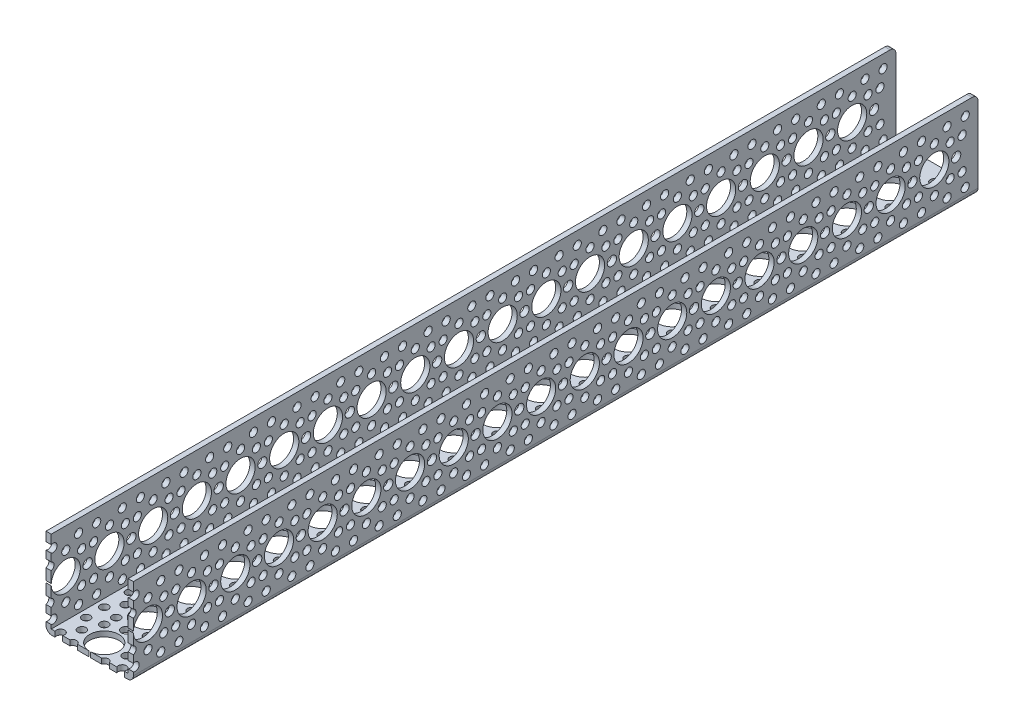
from build123d import *

# Parameters (mm, degrees)
SKETCH1_W                 = 381
SKETCH1_H                 = 38.1
BOSS_EXTRUDE1_DEPTH       = 38.1
SKETCH2_W                 = 33.528
SKETCH2_H                 = 35.814
CUT_EXTRUDE1_DEPTH        = 385.791138152
HOLE1_D                   = 12.7254
HOLE1_DEPTH               = 2.286
F_5_CLEARANCE_HOLE1_D     = 3.556
F_5_CLEARANCE_HOLE1_DEPTH = 2.286
F_6_CLEARANCE_HOLE1_D     = 4.064
F_6_CLEARANCE_HOLE1_DEPTH = 2.286
HOLE2_D                   = 12.7254
HOLE2_DEPTH               = 38.1
F_6_CLEARANCE_HOLE2_D     = 4.064
F_6_CLEARANCE_HOLE2_DEPTH = 38.1
F_5_CLEARANCE_HOLE2_D     = 3.556
F_5_CLEARANCE_HOLE2_DEPTH = 38.1
HOLE3_D                   = 12.7254
HOLE3_DEPTH               = 38.1
F_6_CLEARANCE_HOLE3_D     = 4.064
F_6_CLEARANCE_HOLE3_DEPTH = 38.1
F_5_CLEARANCE_HOLE3_D     = 3.556
F_5_CLEARANCE_HOLE3_DEPTH = 38.1
FILLET1_R                 = 2.54
SKETCH21_W                = 12.7
SKETCH21_H                = 99.950551067
CUT_EXTRUDE2_DEPTH        = 76.2


with BuildPart() as part:
    # Sketch1 → Boss-Extrude1 (new body)
    with BuildSketch(Plane(origin=(38.1, 0, 0), x_dir=(0, 0, -1), z_dir=(1, 0, 0))):
        with Locations((-190.5, 19.05)):
            Rectangle(SKETCH1_W, SKETCH1_H)
    extrude(amount=-BOSS_EXTRUDE1_DEPTH)

    # Sketch2 → Cut-Extrude1 (cut, through all)
    with BuildSketch(Plane.XY.offset(381)):
        with Locations((19.05, 20.193)):
            Rectangle(SKETCH2_W, SKETCH2_H)
    extrude(amount=-CUT_EXTRUDE1_DEPTH, mode=Mode.SUBTRACT)

    # Hole1
    with Locations(Plane.ZY):
        with Locations((38.1, 19.05), (19.05, 19.05), (57.15, 19.05), (76.2, 19.05), (95.25, 19.05), (114.3, 19.05), (133.35, 19.05), (152.4, 19.05), (171.45, 19.05), (190.5, 19.05), (209.55, 19.05), (228.6, 19.05), (247.65, 19.05), (266.7, 19.05), (285.75, 19.05), (304.8, 19.05), (323.85, 19.05), (342.9, 19.05), (361.95, 19.05)):
            Hole(HOLE1_D / 2, depth=HOLE1_DEPTH)

    # #5 Clearance Hole1
    with Locations(Plane.ZY):
        with Locations((367.529615818, 5.579615818), (374.085202787, 12.135202787), (367.529615818, 32.520384182), (374.085202787, 25.964797213), (13.470384182, 5.579615818), (6.914797213, 12.135202787), (13.470384182, 32.520384182), (6.914797213, 25.964797213), (348.479615818, 5.579615818), (329.429615818, 5.579615818), (310.379615818, 5.579615818), (291.329615818, 5.579615818), (272.279615818, 5.579615818), (253.229615818, 5.579615818), (234.179615818, 5.579615818), (215.129615818, 5.579615818), (196.079615818, 5.579615818), (177.029615818, 5.579615818), (157.979615818, 5.579615818), (138.929615818, 5.579615818), (119.879615818, 5.579615818), (100.829615818, 5.579615818), (81.779615818, 5.579615818), (62.729615818, 5.579615818), (43.679615818, 5.579615818), (24.629615818, 5.579615818), (348.479615818, 32.520384182), (329.429615818, 32.520384182), (310.379615818, 32.520384182), (291.329615818, 32.520384182), (272.279615818, 32.520384182), (253.229615818, 32.520384182), (234.179615818, 32.520384182), (215.129615818, 32.520384182), (196.079615818, 32.520384182), (177.029615818, 32.520384182), (157.979615818, 32.520384182), (138.929615818, 32.520384182), (119.879615818, 32.520384182), (100.829615818, 32.520384182), (81.779615818, 32.520384182), (62.729615818, 32.520384182), (43.679615818, 32.520384182), (24.629615818, 32.520384182), (375.420384182, 5.579615818), (375.420384182, 32.520384182), (356.370384182, 5.579615818), (356.370384182, 32.520384182), (337.320384182, 5.579615818), (337.320384182, 32.520384182), (318.270384182, 5.579615818), (318.270384182, 32.520384182), (299.220384182, 5.579615818), (299.220384182, 32.520384182), (280.170384182, 5.579615818), (280.170384182, 32.520384182), (261.120384182, 5.579615818), (261.120384182, 32.520384182), (242.070384182, 5.579615818), (242.070384182, 32.520384182), (223.020384182, 5.579615818), (223.020384182, 32.520384182), (203.970384182, 5.579615818), (203.970384182, 32.520384182), (184.920384182, 5.579615818), (184.920384182, 32.520384182), (165.870384182, 5.579615818), (165.870384182, 32.520384182), (146.820384182, 5.579615818), (146.820384182, 32.520384182), (127.770384182, 5.579615818), (127.770384182, 32.520384182), (108.720384182, 5.579615818), (108.720384182, 32.520384182), (89.670384182, 5.579615818), (89.670384182, 32.520384182), (70.620384182, 5.579615818), (70.620384182, 32.520384182), (51.570384182, 5.579615818), (51.570384182, 32.520384182), (355.035202787, 12.135202787), (361.95, 9.271), (368.864797213, 12.135202787), (368.864797213, 25.964797213), (361.95, 28.829), (335.985202787, 12.135202787), (342.9, 9.271), (349.814797213, 12.135202787), (349.814797213, 25.964797213), (342.9, 28.829), (316.935202787, 12.135202787), (323.85, 9.271), (330.764797213, 12.135202787), (330.764797213, 25.964797213), (323.85, 28.829), (297.885202787, 12.135202787), (304.8, 9.271), (311.714797213, 12.135202787), (311.714797213, 25.964797213), (304.8, 28.829), (278.835202787, 12.135202787), (285.75, 9.271), (292.664797213, 12.135202787), (292.664797213, 25.964797213), (285.75, 28.829), (259.785202787, 12.135202787), (266.7, 9.271), (273.614797213, 12.135202787), (273.614797213, 25.964797213), (266.7, 28.829), (240.735202787, 12.135202787), (247.65, 9.271), (254.564797213, 12.135202787), (254.564797213, 25.964797213), (247.65, 28.829), (221.685202787, 12.135202787), (228.6, 9.271), (235.514797213, 12.135202787), (235.514797213, 25.964797213), (228.6, 28.829), (202.635202787, 12.135202787), (209.55, 9.271), (216.464797213, 12.135202787), (216.464797213, 25.964797213), (209.55, 28.829), (183.585202787, 12.135202787), (190.5, 9.271), (197.414797213, 12.135202787), (197.414797213, 25.964797213), (190.5, 28.829), (164.535202787, 12.135202787), (171.45, 9.271), (178.364797213, 12.135202787), (178.364797213, 25.964797213), (171.45, 28.829), (145.485202787, 12.135202787), (152.4, 9.271), (159.314797213, 12.135202787), (159.314797213, 25.964797213), (152.4, 28.829), (126.435202787, 12.135202787), (133.35, 9.271), (140.264797213, 12.135202787), (140.264797213, 25.964797213), (133.35, 28.829), (107.385202787, 12.135202787), (114.3, 9.271), (121.214797213, 12.135202787), (121.214797213, 25.964797213), (114.3, 28.829), (88.335202787, 12.135202787), (95.25, 9.271), (102.164797213, 12.135202787), (102.164797213, 25.964797213), (95.25, 28.829), (69.285202787, 12.135202787), (76.2, 9.271), (83.114797213, 12.135202787), (83.114797213, 25.964797213), (76.2, 28.829), (50.235202787, 12.135202787), (57.15, 9.271), (64.064797213, 12.135202787), (64.064797213, 25.964797213), (57.15, 28.829), (31.185202787, 12.135202787), (38.1, 9.271), (45.014797213, 12.135202787), (45.014797213, 25.964797213), (38.1, 28.829), (355.035202787, 25.964797213), (335.985202787, 25.964797213), (316.935202787, 25.964797213), (297.885202787, 25.964797213), (278.835202787, 25.964797213), (259.785202787, 25.964797213), (240.735202787, 25.964797213), (221.685202787, 25.964797213), (202.635202787, 25.964797213), (183.585202787, 25.964797213), (164.535202787, 25.964797213), (145.485202787, 25.964797213), (126.435202787, 25.964797213), (107.385202787, 25.964797213), (88.335202787, 25.964797213), (69.285202787, 25.964797213), (50.235202787, 25.964797213), (31.185202787, 25.964797213), (32.520384182, 5.579615818), (32.520384182, 32.520384182), (5.579615818, 5.579615818), (5.579615818, 32.520384182), (12.135202787, 12.135202787), (19.05, 9.271), (25.964797213, 12.135202787), (25.964797213, 25.964797213), (19.05, 28.829), (12.135202787, 25.964797213)):
            Hole(F_5_CLEARANCE_HOLE1_D / 2, depth=F_5_CLEARANCE_HOLE1_DEPTH)

    # #6 Clearance Hole1
    with Locations(Plane.ZY):
        with Locations((371.475, 19.05), (352.425, 19.05), (333.375, 19.05), (314.325, 19.05), (295.275, 19.05), (276.225, 19.05), (257.175, 19.05), (238.125, 19.05), (219.075, 19.05), (200.025, 19.05), (180.975, 19.05), (161.925, 19.05), (142.875, 19.05), (123.825, 19.05), (104.775, 19.05), (85.725, 19.05), (66.675, 19.05), (47.625, 19.05), (28.575, 19.05), (9.525, 19.05)):
            Hole(F_6_CLEARANCE_HOLE1_D / 2, depth=F_6_CLEARANCE_HOLE1_DEPTH)

    # Hole2
    with Locations(Plane(origin=(0, 0, 0), x_dir=(-1, 0, 0), z_dir=(0, -1, 0))):
        with Locations((-19.05, -361.95), (-19.05, -342.9), (-19.05, -323.85), (-19.05, -304.8), (-19.05, -285.75), (-19.05, -266.7), (-19.05, -247.65), (-19.05, -228.6), (-19.05, -209.55), (-19.05, -190.5), (-19.05, -171.45), (-19.05, -152.4), (-19.05, -133.35), (-19.05, -114.3), (-19.05, -95.25), (-19.05, -76.2), (-19.05, -57.15), (-19.05, -38.1), (-19.05, -19.05)):
            Hole(HOLE2_D / 2, depth=HOLE2_DEPTH)

    # #6 Clearance Hole2
    with Locations(Plane(origin=(0, 0, 0), x_dir=(-1, 0, 0), z_dir=(0, -1, 0))):
        with Locations((-19.05, -371.475), (-19.05, -352.425), (-19.05, -333.375), (-19.05, -314.325), (-19.05, -295.275), (-19.05, -276.225), (-19.05, -257.175), (-19.05, -238.125), (-19.05, -219.075), (-19.05, -200.025), (-19.05, -180.975), (-19.05, -161.925), (-19.05, -142.875), (-19.05, -123.825), (-19.05, -104.775), (-19.05, -85.725), (-19.05, -66.675), (-19.05, -47.625), (-19.05, -28.575), (-19.05, -9.525)):
            Hole(F_6_CLEARANCE_HOLE2_D / 2, depth=F_6_CLEARANCE_HOLE2_DEPTH)

    # #5 Clearance Hole2
    with Locations(Plane(origin=(0, 0, 0), x_dir=(-1, 0, 0), z_dir=(0, -1, 0))):
        with Locations((-5.579615818, -375.420384182), (-5.579615818, -367.529615818), (-12.135202787, -374.085202787), (-32.520384182, -375.420384182), (-32.520384182, -367.529615818), (-25.964797213, -374.085202787), (-5.579615818, -356.370384182), (-5.579615818, -348.479615818), (-32.520384182, -356.370384182), (-32.520384182, -348.479615818), (-5.579615818, -337.320384182), (-5.579615818, -329.429615818), (-32.520384182, -337.320384182), (-32.520384182, -329.429615818), (-5.579615818, -318.270384182), (-5.579615818, -310.379615818), (-32.520384182, -318.270384182), (-32.520384182, -310.379615818), (-5.579615818, -299.220384182), (-5.579615818, -291.329615818), (-32.520384182, -299.220384182), (-32.520384182, -291.329615818), (-5.579615818, -280.170384182), (-5.579615818, -272.279615818), (-32.520384182, -280.170384182), (-32.520384182, -272.279615818), (-5.579615818, -261.120384182), (-5.579615818, -253.229615818), (-32.520384182, -261.120384182), (-32.520384182, -253.229615818), (-5.579615818, -242.070384182), (-5.579615818, -234.179615818), (-32.520384182, -242.070384182), (-32.520384182, -234.179615818), (-5.579615818, -223.020384182), (-5.579615818, -215.129615818), (-32.520384182, -223.020384182), (-32.520384182, -215.129615818), (-5.579615818, -203.970384182), (-5.579615818, -196.079615818), (-32.520384182, -203.970384182), (-32.520384182, -196.079615818), (-5.579615818, -184.920384182), (-5.579615818, -177.029615818), (-32.520384182, -184.920384182), (-32.520384182, -177.029615818), (-5.579615818, -165.870384182), (-5.579615818, -157.979615818), (-32.520384182, -165.870384182), (-32.520384182, -157.979615818), (-5.579615818, -146.820384182), (-5.579615818, -138.929615818), (-32.520384182, -146.820384182), (-32.520384182, -138.929615818), (-5.579615818, -127.770384182), (-5.579615818, -119.879615818), (-32.520384182, -127.770384182), (-32.520384182, -119.879615818), (-5.579615818, -108.720384182), (-5.579615818, -100.829615818), (-32.520384182, -108.720384182), (-32.520384182, -100.829615818), (-5.579615818, -89.670384182), (-5.579615818, -81.779615818), (-32.520384182, -89.670384182), (-32.520384182, -81.779615818), (-5.579615818, -70.620384182), (-5.579615818, -62.729615818), (-32.520384182, -70.620384182), (-32.520384182, -62.729615818), (-5.579615818, -51.570384182), (-5.579615818, -43.679615818), (-32.520384182, -51.570384182), (-32.520384182, -43.679615818), (-12.135202787, -355.035202787), (-9.271, -361.95), (-12.135202787, -368.864797213), (-25.964797213, -368.864797213), (-28.829, -361.95), (-25.964797213, -355.035202787), (-12.135202787, -335.985202787), (-9.271, -342.9), (-12.135202787, -349.814797213), (-25.964797213, -349.814797213), (-28.829, -342.9), (-25.964797213, -335.985202787), (-12.135202787, -316.935202787), (-9.271, -323.85), (-12.135202787, -330.764797213), (-25.964797213, -330.764797213), (-28.829, -323.85), (-25.964797213, -316.935202787), (-12.135202787, -297.885202787), (-9.271, -304.8), (-12.135202787, -311.714797213), (-25.964797213, -311.714797213), (-28.829, -304.8), (-25.964797213, -297.885202787), (-12.135202787, -278.835202787), (-9.271, -285.75), (-12.135202787, -292.664797213), (-25.964797213, -292.664797213), (-28.829, -285.75), (-25.964797213, -278.835202787), (-12.135202787, -259.785202787), (-9.271, -266.7), (-12.135202787, -273.614797213), (-25.964797213, -273.614797213), (-28.829, -266.7), (-25.964797213, -259.785202787), (-12.135202787, -240.735202787), (-9.271, -247.65), (-12.135202787, -254.564797213), (-25.964797213, -254.564797213), (-28.829, -247.65), (-25.964797213, -240.735202787), (-12.135202787, -221.685202787), (-9.271, -228.6), (-12.135202787, -235.514797213), (-25.964797213, -235.514797213), (-28.829, -228.6), (-25.964797213, -221.685202787), (-12.135202787, -202.635202787), (-9.271, -209.55), (-12.135202787, -216.464797213), (-25.964797213, -216.464797213), (-28.829, -209.55), (-25.964797213, -202.635202787), (-12.135202787, -183.585202787), (-9.271, -190.5), (-12.135202787, -197.414797213), (-25.964797213, -197.414797213), (-28.829, -190.5), (-25.964797213, -183.585202787), (-12.135202787, -164.535202787), (-9.271, -171.45), (-12.135202787, -178.364797213), (-25.964797213, -178.364797213), (-28.829, -171.45), (-25.964797213, -164.535202787), (-12.135202787, -145.485202787), (-9.271, -152.4), (-12.135202787, -159.314797213), (-25.964797213, -159.314797213), (-28.829, -152.4), (-25.964797213, -145.485202787), (-12.135202787, -126.435202787), (-9.271, -133.35), (-12.135202787, -140.264797213), (-25.964797213, -140.264797213), (-28.829, -133.35), (-25.964797213, -126.435202787), (-12.135202787, -107.385202787), (-9.271, -114.3), (-12.135202787, -121.214797213), (-25.964797213, -121.214797213), (-28.829, -114.3), (-25.964797213, -107.385202787), (-12.135202787, -88.335202787), (-9.271, -95.25), (-12.135202787, -102.164797213), (-25.964797213, -102.164797213), (-28.829, -95.25), (-25.964797213, -88.335202787), (-12.135202787, -69.285202787), (-9.271, -76.2), (-12.135202787, -83.114797213), (-25.964797213, -83.114797213), (-28.829, -76.2), (-25.964797213, -69.285202787), (-12.135202787, -50.235202787), (-9.271, -57.15), (-12.135202787, -64.064797213), (-25.964797213, -64.064797213), (-28.829, -57.15), (-25.964797213, -50.235202787), (-9.271, -38.1), (-12.135202787, -45.014797213), (-25.964797213, -45.014797213), (-28.829, -38.1), (-5.579615818, -32.520384182), (-5.579615818, -24.629615818), (-12.135202787, -31.185202787), (-32.520384182, -32.520384182), (-32.520384182, -24.629615818), (-25.964797213, -31.185202787), (-5.579615818, -5.579615818), (-5.579615818, -13.470384182), (-12.135202787, -6.914797213), (-32.520384182, -5.579615818), (-32.520384182, -13.470384182), (-25.964797213, -6.914797213), (-12.135202787, -12.135202787), (-9.271, -19.05), (-12.135202787, -25.964797213), (-25.964797213, -25.964797213), (-28.829, -19.05), (-25.964797213, -12.135202787)):
            Hole(F_5_CLEARANCE_HOLE2_D / 2, depth=F_5_CLEARANCE_HOLE2_DEPTH)

    # Hole3
    with Locations(Plane(origin=(38.1, 0, 0), x_dir=(0, 0, -1), z_dir=(1, 0, 0))):
        with Locations((-38.1, 19.05), (-19.05, 19.05), (-57.15, 19.05), (-76.2, 19.05), (-95.25, 19.05), (-114.3, 19.05), (-133.35, 19.05), (-152.4, 19.05), (-171.45, 19.05), (-190.5, 19.05), (-209.55, 19.05), (-228.6, 19.05), (-247.65, 19.05), (-266.7, 19.05), (-285.75, 19.05), (-304.8, 19.05), (-323.85, 19.05), (-342.9, 19.05), (-361.95, 19.05)):
            Hole(HOLE3_D / 2, depth=HOLE3_DEPTH)

    # #6 Clearance Hole3
    with Locations(Plane(origin=(38.1, 0, 0), x_dir=(0, 0, -1), z_dir=(1, 0, 0))):
        with Locations((-352.425, 19.05), (-314.325, 19.05), (-276.225, 19.05), (-238.125, 19.05), (-200.025, 19.05), (-161.925, 19.05), (-123.825, 19.05), (-85.725, 19.05), (-47.625, 19.05), (-28.575, 19.05), (-9.525, 19.05), (-66.675, 19.05), (-104.775, 19.05), (-142.875, 19.05), (-180.975, 19.05), (-219.075, 19.05), (-257.175, 19.05), (-295.275, 19.05), (-333.375, 19.05), (-371.475, 19.05)):
            Hole(F_6_CLEARANCE_HOLE3_D / 2, depth=F_6_CLEARANCE_HOLE3_DEPTH)

    # #5 Clearance Hole3
    with Locations(Plane(origin=(38.1, 0, 0), x_dir=(0, 0, -1), z_dir=(1, 0, 0))):
        with Locations((-367.529615818, 5.579615818), (-367.529615818, 32.520384182), (-13.470384182, 5.579615818), (-348.479615818, 5.579615818), (-310.379615818, 5.579615818), (-272.279615818, 5.579615818), (-234.179615818, 5.579615818), (-196.079615818, 5.579615818), (-157.979615818, 5.579615818), (-119.879615818, 5.579615818), (-81.779615818, 5.579615818), (-43.679615818, 5.579615818), (-348.479615818, 32.520384182), (-310.379615818, 32.520384182), (-272.279615818, 32.520384182), (-234.179615818, 32.520384182), (-196.079615818, 32.520384182), (-157.979615818, 32.520384182), (-119.879615818, 32.520384182), (-81.779615818, 32.520384182), (-43.679615818, 32.520384182), (-375.420384182, 5.579615818), (-356.370384182, 5.579615818), (-337.320384182, 5.579615818), (-318.270384182, 5.579615818), (-299.220384182, 5.579615818), (-280.170384182, 5.579615818), (-261.120384182, 5.579615818), (-242.070384182, 5.579615818), (-223.020384182, 5.579615818), (-203.970384182, 5.579615818), (-184.920384182, 5.579615818), (-165.870384182, 5.579615818), (-146.820384182, 5.579615818), (-127.770384182, 5.579615818), (-108.720384182, 5.579615818), (-89.670384182, 5.579615818), (-70.620384182, 5.579615818), (-51.570384182, 5.579615818), (-361.95, 9.271), (-368.864797213, 25.964797213), (-335.985202787, 12.135202787), (-349.814797213, 12.135202787), (-342.9, 28.829), (-323.85, 9.271), (-330.764797213, 25.964797213), (-297.885202787, 12.135202787), (-311.714797213, 12.135202787), (-304.8, 28.829), (-285.75, 9.271), (-292.664797213, 25.964797213), (-259.785202787, 12.135202787), (-273.614797213, 12.135202787), (-266.7, 28.829), (-247.65, 9.271), (-254.564797213, 25.964797213), (-221.685202787, 12.135202787), (-235.514797213, 12.135202787), (-228.6, 28.829), (-209.55, 9.271), (-216.464797213, 25.964797213), (-183.585202787, 12.135202787), (-197.414797213, 12.135202787), (-190.5, 28.829), (-171.45, 9.271), (-178.364797213, 25.964797213), (-145.485202787, 12.135202787), (-159.314797213, 12.135202787), (-152.4, 28.829), (-133.35, 9.271), (-140.264797213, 25.964797213), (-107.385202787, 12.135202787), (-121.214797213, 12.135202787), (-114.3, 28.829), (-95.25, 9.271), (-102.164797213, 25.964797213), (-69.285202787, 12.135202787), (-83.114797213, 12.135202787), (-76.2, 28.829), (-57.15, 9.271), (-64.064797213, 25.964797213), (-31.185202787, 12.135202787), (-45.014797213, 12.135202787), (-38.1, 28.829), (-335.985202787, 25.964797213), (-297.885202787, 25.964797213), (-259.785202787, 25.964797213), (-221.685202787, 25.964797213), (-183.585202787, 25.964797213), (-145.485202787, 25.964797213), (-107.385202787, 25.964797213), (-69.285202787, 25.964797213), (-31.185202787, 25.964797213), (-32.520384182, 5.579615818), (-32.520384182, 32.520384182), (-5.579615818, 5.579615818), (-5.579615818, 32.520384182), (-12.135202787, 12.135202787), (-19.05, 9.271), (-25.964797213, 12.135202787), (-25.964797213, 25.964797213), (-19.05, 28.829), (-12.135202787, 25.964797213), (-50.235202787, 25.964797213), (-88.335202787, 25.964797213), (-126.435202787, 25.964797213), (-164.535202787, 25.964797213), (-202.635202787, 25.964797213), (-240.735202787, 25.964797213), (-278.835202787, 25.964797213), (-316.935202787, 25.964797213), (-355.035202787, 25.964797213), (-45.014797213, 25.964797213), (-38.1, 9.271), (-57.15, 28.829), (-64.064797213, 12.135202787), (-50.235202787, 12.135202787), (-83.114797213, 25.964797213), (-76.2, 9.271), (-95.25, 28.829), (-102.164797213, 12.135202787), (-88.335202787, 12.135202787), (-121.214797213, 25.964797213), (-114.3, 9.271), (-133.35, 28.829), (-140.264797213, 12.135202787), (-126.435202787, 12.135202787), (-159.314797213, 25.964797213), (-152.4, 9.271), (-171.45, 28.829), (-178.364797213, 12.135202787), (-164.535202787, 12.135202787), (-197.414797213, 25.964797213), (-190.5, 9.271), (-209.55, 28.829), (-216.464797213, 12.135202787), (-202.635202787, 12.135202787), (-235.514797213, 25.964797213), (-228.6, 9.271), (-247.65, 28.829), (-254.564797213, 12.135202787), (-240.735202787, 12.135202787), (-273.614797213, 25.964797213), (-266.7, 9.271), (-285.75, 28.829), (-292.664797213, 12.135202787), (-278.835202787, 12.135202787), (-311.714797213, 25.964797213), (-304.8, 9.271), (-323.85, 28.829), (-330.764797213, 12.135202787), (-316.935202787, 12.135202787), (-349.814797213, 25.964797213), (-342.9, 9.271), (-361.95, 28.829), (-368.864797213, 12.135202787), (-355.035202787, 12.135202787), (-51.570384182, 32.520384182), (-70.620384182, 32.520384182), (-89.670384182, 32.520384182), (-108.720384182, 32.520384182), (-127.770384182, 32.520384182), (-146.820384182, 32.520384182), (-165.870384182, 32.520384182), (-184.920384182, 32.520384182), (-203.970384182, 32.520384182), (-223.020384182, 32.520384182), (-242.070384182, 32.520384182), (-261.120384182, 32.520384182), (-280.170384182, 32.520384182), (-299.220384182, 32.520384182), (-318.270384182, 32.520384182), (-337.320384182, 32.520384182), (-356.370384182, 32.520384182), (-375.420384182, 32.520384182), (-24.629615818, 32.520384182), (-62.729615818, 32.520384182), (-100.829615818, 32.520384182), (-138.929615818, 32.520384182), (-177.029615818, 32.520384182), (-215.129615818, 32.520384182), (-253.229615818, 32.520384182), (-291.329615818, 32.520384182), (-329.429615818, 32.520384182), (-24.629615818, 5.579615818), (-62.729615818, 5.579615818), (-100.829615818, 5.579615818), (-138.929615818, 5.579615818), (-177.029615818, 5.579615818), (-215.129615818, 5.579615818), (-253.229615818, 5.579615818), (-291.329615818, 5.579615818), (-329.429615818, 5.579615818), (-6.914797213, 25.964797213), (-13.470384182, 32.520384182), (-6.914797213, 12.135202787), (-374.085202787, 25.964797213), (-374.085202787, 12.135202787)):
            Hole(F_5_CLEARANCE_HOLE3_D / 2, depth=F_5_CLEARANCE_HOLE3_DEPTH)

    # Fillet1
    fillet1_edges = [part.edges().sort_by_distance(p)[0] for p in [
        (0, 0, 190.5),
        (1.143, 38.1, 381),
        (1.143, 38.1, 0),
        (36.957, 38.1, 381),
        (36.957, 38.1, 0),
        (38.1, 0, 190.5),
    ]]
    fillet(fillet1_edges, radius=FILLET1_R)

    # Sketch21 → Cut-Extrude2 (cut)
    with BuildSketch(Plane(origin=(38.1, 0, 0), x_dir=(0, 0, -1), z_dir=(1, 0, 0))):
        with Locations((-374.65, 8.754664267)):
            Rectangle(SKETCH21_W, SKETCH21_H)
    extrude(amount=-CUT_EXTRUDE2_DEPTH, mode=Mode.SUBTRACT)


solid = part.part
